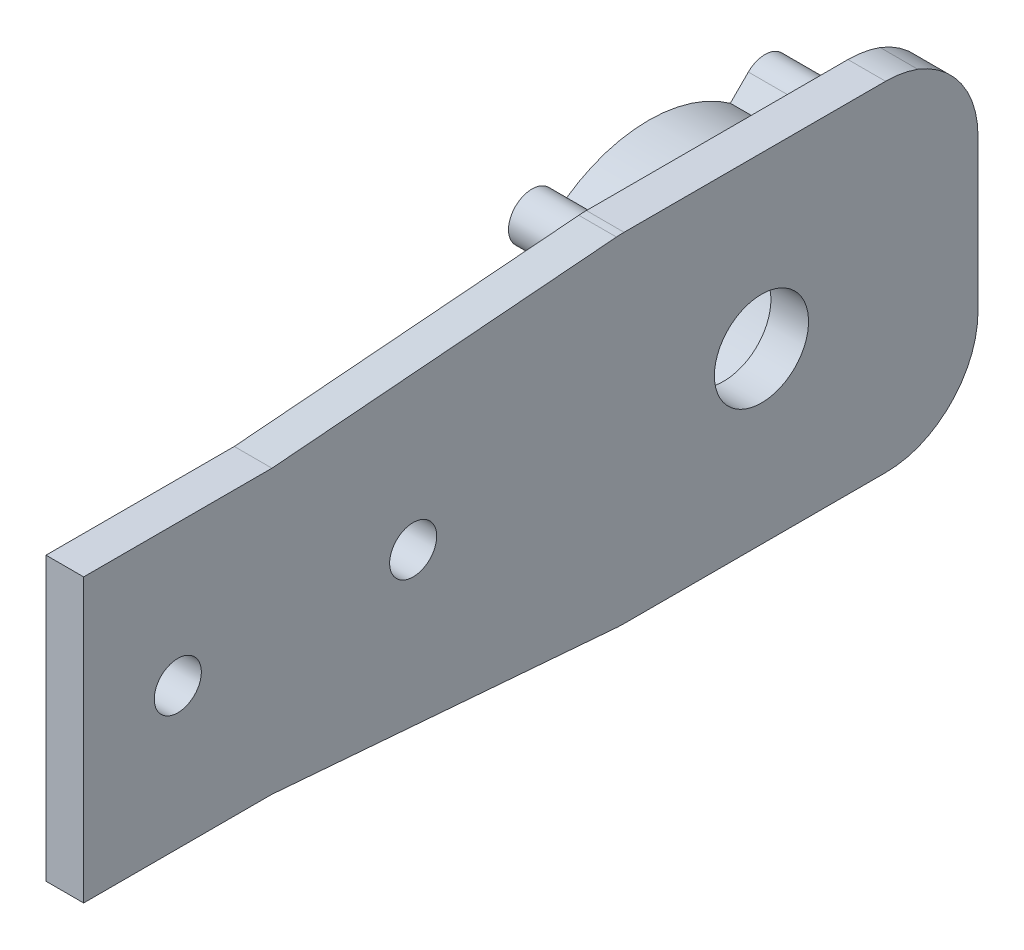
from build123d import *

# Parameters (mm, degrees)
SKETCH1_W           = 4
SKETCH1_H           = 75
BOSS_EXTRUDE1_DEPTH = 30
SKETCH4_R           = 0.5
SKETCH4_R_2         = 11.3
BOSS_EXTRUDE2_DEPTH = 8
BOSS_EXTRUDE3_DEPTH = 4
FILLET1_R           = 10
SKETCH9_R           = 2.5
SKETCH9_R_2         = 5
CUT_EXTRUDE2_DEPTH  = 4


with BuildPart() as part:
    # Sketch1 → Boss-Extrude1 (new body)
    with BuildSketch(Plane(origin=(0, 0, 0), x_dir=(1, 0, 0), z_dir=(0, 1, 0))):
        with Locations((16, -6.5)):
            Rectangle(SKETCH1_W, SKETCH1_H)
    extrude(amount=BOSS_EXTRUDE1_DEPTH)

    # Sketch4 → Boss-Extrude2 (add)
    with BuildSketch(Plane.ZY.offset(-14)):
        with BuildLine():
            Line((-22.142135624, 25.606601718), (-20.226017285, 23.690483379))
            ThreePointArc((-20.226017285, 23.690483379), (-23, 15), (-20.226017285, 6.309516621))
            Line((-20.226017285, 6.309516621), (-22.142135624, 4.393398282))
            ThreePointArc((-22.142135624, 4.393398282), (-22.142135624, 0.857864376), (-18.606601718, 0.857864376))
            Line((-18.606601718, 0.857864376), (-16.690483379, 2.773982715))
            ThreePointArc((-16.690483379, 2.773982715), (-8, 0), (0.690483379, 2.773982715))
            Line((0.690483379, 2.773982715), (2.606601718, 0.857864376))
            ThreePointArc((2.606601718, 0.857864376), (6.142135624, 0.857864376), (6.142135624, 4.393398282))
            Line((6.142135624, 4.393398282), (4.226017285, 6.309516621))
            ThreePointArc((4.226017285, 6.309516621), (7, 15), (4.226017285, 23.690483379))
            Line((4.226017285, 23.690483379), (6.142135624, 25.606601718))
            ThreePointArc((6.142135624, 25.606601718), (6.142135624, 29.142135624), (2.606601718, 29.142135624))
            Line((2.606601718, 29.142135624), (0.690483379, 27.226017285))
            ThreePointArc((0.690483379, 27.226017285), (-8, 30), (-16.690483379, 27.226017285))
            Line((-16.690483379, 27.226017285), (-18.606601718, 29.142135624))
            ThreePointArc((-18.606601718, 29.142135624), (-22.142135624, 29.142135624), (-22.142135624, 25.606601718))
        make_face()
        with Locations(Location((-20.374368671, 27.374368671, 0), (0, 0, 180))):
            Circle(SKETCH4_R, mode=Mode.SUBTRACT)
        with Locations((-8, 15)):
            Circle(SKETCH4_R_2, mode=Mode.SUBTRACT)
        with Locations(Location((4.374368671, 27.374368671, 0), (0, 0, 180))):
            Circle(SKETCH4_R, mode=Mode.SUBTRACT)
        with Locations(Location((4.374368671, 2.625631329, 0), (0, 0, 180))):
            Circle(SKETCH4_R, mode=Mode.SUBTRACT)
        with Locations(Location((-20.374368671, 2.625631329, 0), (0, 0, 180))):
            Circle(SKETCH4_R, mode=Mode.SUBTRACT)
    extrude(amount=BOSS_EXTRUDE2_DEPTH)

    # Sketch5 → Boss-Extrude3 (add)
    with BuildSketch(Plane.ZY.offset(-14)):
        Polygon((-31, 0), (-23, -3), (7, -3), (44, 0), (64, 0), (64, 30), (44, 30), (7, 33), (-23, 33), (-31, 30), align=None)
    extrude(amount=-BOSS_EXTRUDE3_DEPTH)

    # Fillet1
    # the kernel refuses this fillet: 10 mm, written as the material it takes off along each edge
    with BuildSketch(Plane(origin=(-3.325011704, 30, -31), x_dir=(0, 0.3511234415883908, 0.9363291775690449), z_dir=(1, 0, 0))) as fillet1_piece_1:
        with BuildLine():
            CenterArc((FILLET1_R * 0.693000468165, FILLET1_R), FILLET1_R, 200.55604522, 69.44395478)
            Line((-FILLET1_R * 0.243328709404, FILLET1_R * 0.648876558412), (0, 0))
            Line((0, 0), (FILLET1_R * 0.693000468165, 0))
        make_face()
    extrude(amount=38.650023408, mode=Mode.SUBTRACT)
    with BuildSketch(Plane(origin=(-3.325011704, 0, -31), x_dir=(0, -0.3511234415883923, 0.9363291775690443), z_dir=(1, 0, 0))) as fillet1_piece_2:
        with BuildLine():
            CenterArc((FILLET1_R * 0.693000468165, -FILLET1_R), FILLET1_R, 90, 69.44395478)
            Line((-FILLET1_R * 0.243328709404, -FILLET1_R * 0.648876558412), (0, 0))
            Line((0, 0), (FILLET1_R * 0.693000468165, 0))
        make_face()
    extrude(amount=38.650023408, mode=Mode.SUBTRACT)
    with BuildSketch(Plane(origin=(12.988146779, 33, 7), x_dir=(0, -0.0808158687660647, 0.9967290481146751), z_dir=(1, 0, 0)), Plane(origin=(12.988146779, -3, 7), x_dir=(0, 0, -1), z_dir=(1, 0, 0))) as fillet1_piece_3:
        with BuildLine():
            CenterArc((FILLET1_R * 0.0404741288471, FILLET1_R), FILLET1_R, 265.364536573, 4.635463427)
            Line((-FILLET1_R * 0.040341739919, FILLET1_R * 0.00327095188532), (0, 0))
            Line((0, 0), (FILLET1_R * 0.0404741288471, 0))
        make_face()
    extrude(amount=6.023706442, mode=Mode.SUBTRACT)
    with BuildSketch(Plane(origin=(9.466635456, 33, -23), x_dir=(0, 0, 1), z_dir=(1, 0, 0)), Plane(origin=(9.466635456, -3, -23), x_dir=(0, 0.35112344158839215, -0.9363291775690443), z_dir=(1, 0, 0))) as fillet1_piece_4:
        with BuildLine():
            CenterArc((FILLET1_R * 0.181334581773, FILLET1_R), FILLET1_R, 249.44395478, 20.55604522)
            Line((-FILLET1_R * 0.169788859816, FILLET1_R * 0.063670822431), (0, 0))
            Line((0, 0), (FILLET1_R * 0.181334581773, 0))
        make_face()
    extrude(amount=13.066729089, mode=Mode.SUBTRACT)

    # Sketch9 → Cut-Extrude2 (cut)
    with BuildSketch(Plane.ZY.offset(-14)):
        with Locations((54, 15)):
            Circle(SKETCH9_R)
        with Locations((29, 15)):
            Circle(SKETCH9_R)
        with Locations((-8, 15)):
            Circle(SKETCH9_R_2)
    extrude(amount=-CUT_EXTRUDE2_DEPTH, mode=Mode.SUBTRACT)


solid = part.part
